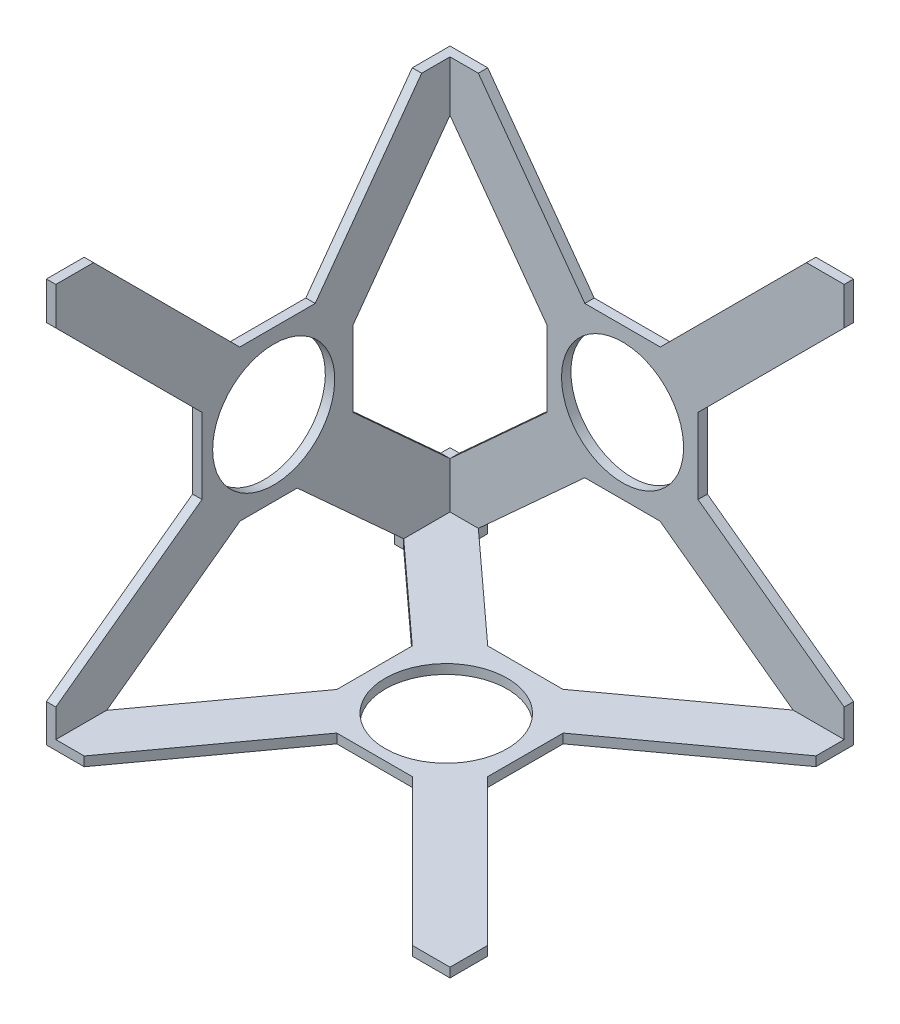
from build123d import *

# Parameters (mm, degrees)
SKETCH1_W           = 85.95
SKETCH1_H           = 85.95
BOSS_EXTRUDE1_DEPTH = 85.95
SKETCH2_W           = 83.95
SKETCH2_H           = 83.95
CUT_EXTRUDE1_DEPTH  = 83.95
CAVITY1_OUTLINE_R   = 13
CAVITY1_DEPTH       = 2
CAVITY2_OUTLINE_R   = 13
CAVITY2_DEPTH       = 2
CAVITY4_START       = -85.95
CAVITY4_OUTLINE_R   = 13
CAVITY4_DEPTH       = 2
CUT_EXTRUDE3_DEPTH  = 148.724092483
BOSS_EXTRUDE2_DEPTH = 2
CUT_EXTRUDE4_REACH  = 150.87
SKETCH8_W           = 2
SKETCH8_H           = 63.308692683
CUT_EXTRUDE5_REACH  = 150.87
SKETCH9_W           = 67.031257487
SKETCH9_H           = 2
CUT_EXTRUDE6_START  = -2
SKETCH10_W          = 2
SKETCH10_H          = 63.308692683
CUT_EXTRUDE6_DEPTH  = 2


# Read off the part's stored shape, not the designer's step: Cavity1, Cavity2, Cavity4
with BuildPart() as part:
    # Sketch1 → Boss-Extrude1 (new body)
    with BuildSketch(Plane.XY):
        with Locations((42.975, -42.975)):
            Rectangle(SKETCH1_W, SKETCH1_H)
    extrude(amount=BOSS_EXTRUDE1_DEPTH)

    # Sketch2 → Cut-Extrude1 (cut)
    with BuildSketch(Plane(origin=(0, 0, 0), x_dir=(1, 0, 0), z_dir=(0, 1, 0))):
        with Locations((43.975, -43.975)):
            Rectangle(SKETCH2_W, SKETCH2_H)
    extrude(amount=-CUT_EXTRUDE1_DEPTH, mode=Mode.SUBTRACT)

    # Cavity1 outline → Cavity1 (cut)
    with BuildSketch(Plane.XY):
        with Locations((38.75, -47.2)):
            Circle(CAVITY1_OUTLINE_R)
    extrude(amount=CAVITY1_DEPTH, mode=Mode.SUBTRACT)

    # Cavity2 outline → Cavity2 (cut)
    with BuildSketch(Plane.YZ):
        with Locations((-47.2, 39.55)):
            Circle(CAVITY2_OUTLINE_R)
    extrude(amount=CAVITY2_DEPTH, mode=Mode.SUBTRACT)

    # Cavity4 outline → Cavity4 (cut)
    with BuildSketch(Plane(origin=(0, 0, 0), x_dir=(1, 0, 0), z_dir=(0, 1, 0)).offset(CAVITY4_START)):
        with Locations((38.75, -39.55)):
            Circle(CAVITY4_OUTLINE_R)
    extrude(amount=CAVITY4_DEPTH, mode=Mode.SUBTRACT)

    # Sketch4 → Cut-Extrude3 (cut, through all)
    with BuildSketch(Plane.XY.offset(2)):
        Polygon((46.786231243, -31.127537514), (77.913768757, 0), (8.036231243, 0), (30.713768757, -31.127537514), align=None)
        Polygon((54.822462486, -39.163768757), (85.95, -8.036231243), (85.95, -77.939325412), (54.822462486, -55.236231243), align=None)
        Polygon((46.717131732, -63.272462486), (75.06748873, -83.95), (8.036231243, -83.95), (30.713768757, -63.272462486), align=None)
        Polygon((22.677537514, -39.163768757), (2, -10.781462068), (2, -74.090154751), (22.677537514, -55.236231243), align=None)
    cut_extrude3 = extrude(amount=-CUT_EXTRUDE3_DEPTH, mode=Mode.SUBTRACT)

    # Mirror1: Cut-Extrude3 across plane
    add(cut_extrude3.mirror(Plane(origin=(0, -42.975, 42.975), x_dir=(0, 0.7071067811865475, 0.7071067811865477), z_dir=(0, 0.7071067811865476, -0.7071067811865475))), mode=Mode.SUBTRACT)

    # Mirror2: Cut-Extrude3 across plane
    add(cut_extrude3.mirror(Plane(origin=(0, 0, 0), x_dir=(0.7071067811865478, 0, 0.7071067811865472), z_dir=(-0.7071067811865475, 0, 0.7071067811865477))), mode=Mode.SUBTRACT)

    # Sketch6 → Boss-Extrude2 (add)
    with BuildSketch(Plane(origin=(2, 0, 0), x_dir=(0, 0, -1), z_dir=(1, 0, 0))):
        Polygon((-8.036231243, -83.95), (-11.859845249, -83.95), (-34.537382763, -63.272462486), (-30.713768757, -63.272462486), align=None)
    extrude(amount=-BOSS_EXTRUDE2_DEPTH)

    # Cut-Extrude4: up to this face of the body (flat: up to its plane)
    cut_extrude4_end = Plane(part.part.faces().sort_by_distance((18.575077405, -83.95, 13.216062518))[0])
    # Sketch8 → Cut-Extrude4 (cut, up to the picked face)
    with BuildSketch(Plane.XZ.offset(85.95), mode=Mode.PRIVATE) as cut_extrude4_sk1:
        with Locations((1, 43.514191591)):
            Rectangle(SKETCH8_W, SKETCH8_H)
    cut_extrude4_tool1 = split(extrude(cut_extrude4_sk1.sketch, amount=-CUT_EXTRUDE4_REACH, mode=Mode.PRIVATE), bisect_by=cut_extrude4_end, keep=Keep.BOTH, mode=Mode.PRIVATE)
    add(cut_extrude4_tool1.solids().sort_by(Axis((1, -85.95, 43.514192), (0, 1, 0)))[0], mode=Mode.SUBTRACT)

    # Cut-Extrude5: up to this face of the body (flat: up to its plane)
    cut_extrude5_end = Plane(part.part.faces().sort_by_distance((41.551859986, -83.95, 1))[0])
    # Sketch9 → Cut-Extrude5 (cut, up to the picked face)
    with BuildSketch(Plane.XZ.offset(85.95), mode=Mode.PRIVATE) as cut_extrude5_sk1:
        with Locations((41.551859987, 1)):
            Rectangle(SKETCH9_W, SKETCH9_H)
    cut_extrude5_tool1 = split(extrude(cut_extrude5_sk1.sketch, amount=-CUT_EXTRUDE5_REACH, mode=Mode.PRIVATE), bisect_by=cut_extrude5_end, keep=Keep.BOTH, mode=Mode.PRIVATE)
    add(cut_extrude5_tool1.solids().sort_by(Axis((41.55186, -85.95, 1), (0, 1, 0)))[0], mode=Mode.SUBTRACT)

    # Sketch10 → Cut-Extrude6 (cut)
    with BuildSketch(Plane.ZY.offset(CUT_EXTRUDE6_START)):
        with Locations((1, -42.435808409)):
            Rectangle(SKETCH10_W, SKETCH10_H)
    extrude(amount=CUT_EXTRUDE6_DEPTH, mode=Mode.SUBTRACT)


solid = part.part
